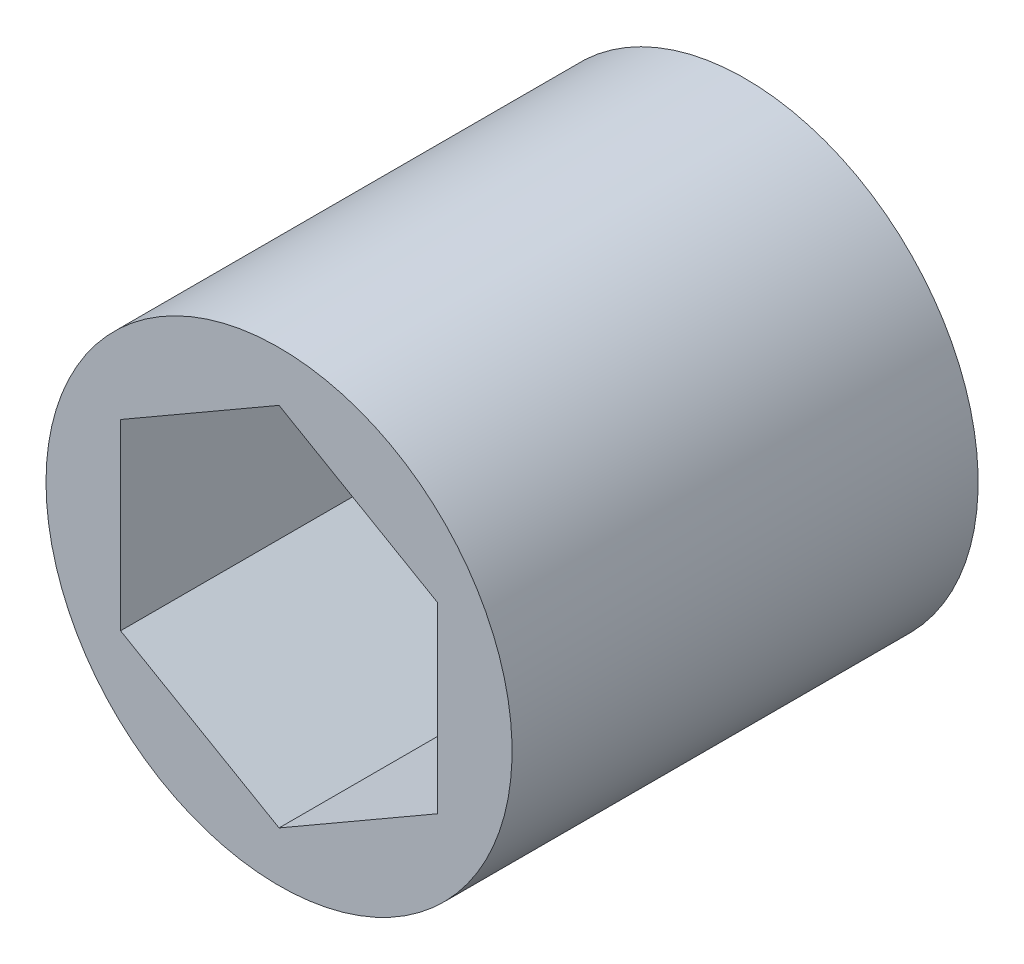
from build123d import *

# Parameters (mm, degrees)
SKETCH1_R           = 9.525
BOSS_EXTRUDE1_DEPTH = 9.525


with BuildPart() as part:
    # Sketch1 → Boss-Extrude1 (new, symmetric)
    with BuildSketch(Plane.XY):
        Circle(SKETCH1_R)
        Polygon((0, 7.478995387), (-6.477, 3.739497694), (-6.477, -3.739497694), (0, -7.478995387), (6.477, -3.739497694), (6.477, 3.739497694), align=None, mode=Mode.SUBTRACT)
    extrude(amount=BOSS_EXTRUDE1_DEPTH, both=True)


solid = part.part
